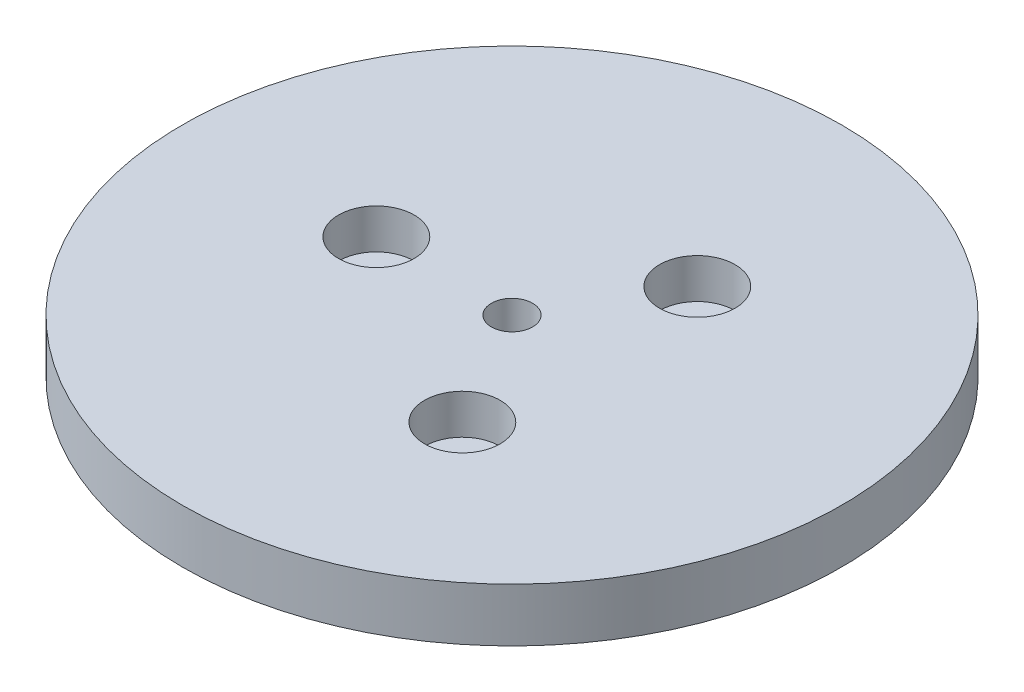
from build123d import *

# Parameters (mm, degrees)
SKETCH1_R           = 80
BOSS_EXTRUDE1_DEPTH = 13
SKETCH2_R           = 5
CUT_EXTRUDE1_DEPTH  = 114.881517377
SKETCH3_R           = 9.174679193
CUT_EXTRUDE2_DEPTH  = 9.668797885
CIRPATTERN1_COUNT   = 3


with BuildPart() as part:
    # Sketch1 → Boss-Extrude1 (new body)
    with BuildSketch(Plane(origin=(0, 0, 0), x_dir=(1, 0, 0), z_dir=(0, 1, 0))):
        Circle(SKETCH1_R)
    extrude(amount=BOSS_EXTRUDE1_DEPTH)

    # Sketch2 → Cut-Extrude1 (cut, through all)
    with BuildSketch(Plane(origin=(0, 0, 0), x_dir=(1, 0, 0), z_dir=(0, 1, 0))):
        Circle(SKETCH2_R)
    extrude(amount=CUT_EXTRUDE1_DEPTH, mode=Mode.SUBTRACT)

    # Sketch3 → Cut-Extrude2 (cut)
    with BuildSketch(Plane(origin=(0, 13, 0), x_dir=(1, 0, 0), z_dir=(0, 1, 0))):
        with Locations((-32.930062832, 0)):
            Circle(SKETCH3_R)
    cut_extrude2 = extrude(amount=-CUT_EXTRUDE2_DEPTH, mode=Mode.SUBTRACT)

    # CirPattern1: Cut-Extrude2 ×3 about axis
    cirpattern1_axis = Axis((0, 0, 0), (0, 1, 0))
    for i in range(1, CIRPATTERN1_COUNT):
        add(cut_extrude2.rotate(cirpattern1_axis, i * 360 / CIRPATTERN1_COUNT), mode=Mode.SUBTRACT)


solid = part.part
